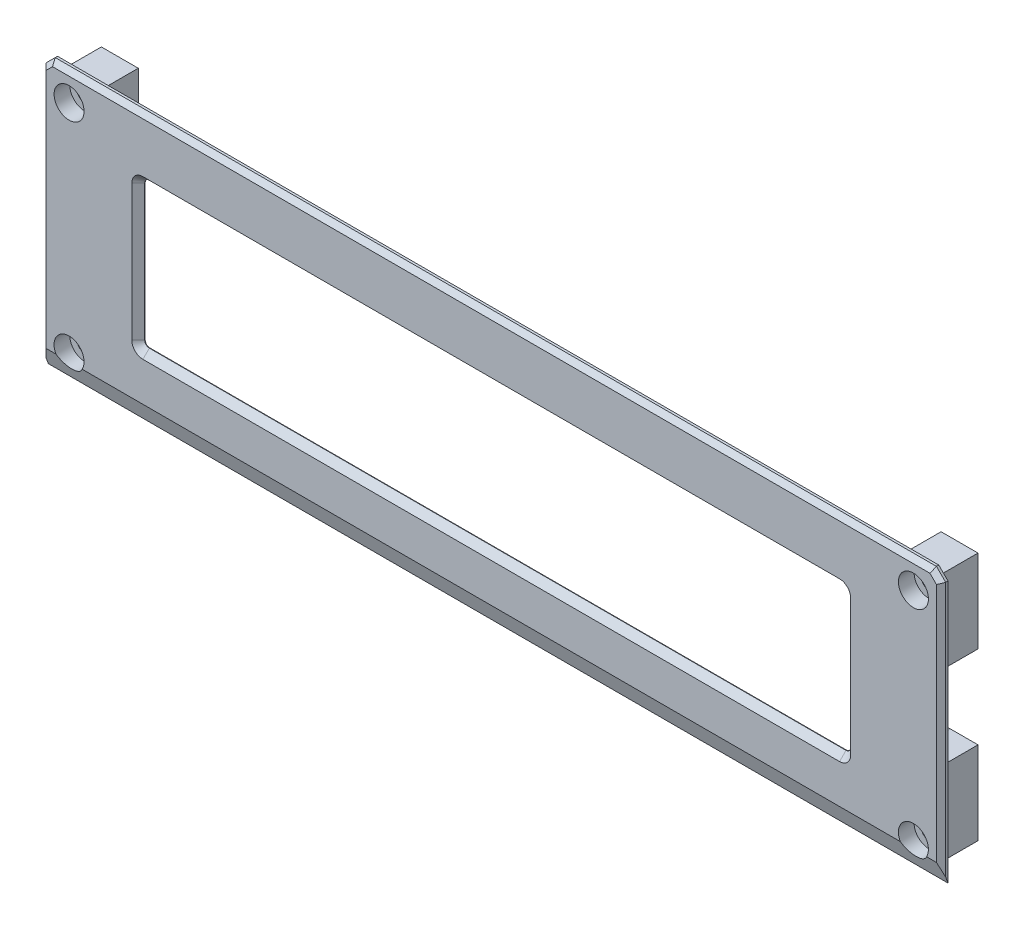
from build123d import *

# Parameters (mm, degrees)
CROQUIS1_W                                           = 195
CROQUIS1_H                                           = 58.7
CROQUIS1_W_2                                         = 153
CROQUIS1_H_2                                         = 31.5
SALIENTE_EXTRUIR1_DEPTH                              = 1.5
REDONDEO1_R                                          = 1
CHAFL_N1_SIZE                                        = 1.4
CORTAR_EXTRUIR1_DEPTH                                = 198.22449138
CROQUIS3_W                                           = 8
CROQUIS3_H                                           = 18
CROQUIS3_H_2                                         = 10
SALIENTE_EXTRUIR2_DEPTH                              = 9
CROQUIS4_W                                           = 174
CROQUIS4_H                                           = 4
CROQUIS4_W_2                                         = 4
CROQUIS4_H_2                                         = 18
CROQUIS4_H_3                                         = 34
SALIENTE_EXTRUIR3_DEPTH                              = 2
REDONDEO2_R                                          = 2
REFRENTADO_PARA_TORNILLO_CON_CABEZA_HUEC_D           = 3.4
REFRENTADO_PARA_TORNILLO_CON_CABEZA_HUEC_CBORE_D     = 6.5
REFRENTADO_PARA_TORNILLO_CON_CABEZA_HUEC_CBORE_DEPTH = 3.4
CHAFL_N2_SIZE                                        = 2
CHAFL_N3_SIZE                                        = 1


with BuildPart() as part:
    # Croquis1 → Saliente-Extruir1 (new body)
    with BuildSketch(Plane.XY):
        with Locations((0, 0.15)):
            Rectangle(CROQUIS1_W, CROQUIS1_H)
        with Locations((0, 0.51)):
            Rectangle(CROQUIS1_W_2, CROQUIS1_H_2, mode=Mode.SUBTRACT)
    extrude(amount=SALIENTE_EXTRUIR1_DEPTH)

    # Redondeo1
    redondeo1_edges = [part.edges().sort_by_distance(p)[0] for p in [
        (-76.5, 16.26, 0.75),
        (-76.5, -15.24, 0.75),
        (76.5, -15.24, 0.75),
        (76.5, 16.26, 0.75),
    ]]
    fillet(redondeo1_edges, radius=REDONDEO1_R)

    # Chaflán1
    chafl_n1_edges = [part.edges().sort_by_distance(p)[0] for p in [
        (-76.5, 0.51, 1.5),
        (0, -15.24, 1.5),
        (76.5, 0.51, 1.5),
        (0, 16.26, 1.5),
        (-76.207106781, -14.947106781, 1.5),
        (76.207106781, -14.947106781, 1.5),
        (76.207106781, 15.967106781, 1.5),
        (-76.207106781, 15.967106781, 1.5),
    ]]
    chamfer(chafl_n1_edges, length=CHAFL_N1_SIZE)

    # Croquis2 → Cortar-Extruir1 (cut, through all)
    with BuildSketch(Plane(origin=(97.5, 0, 0), x_dir=(0, 0, -1), z_dir=(1, 0, 0))):
        Polygon((0, -29.2), (-1.5, -25.078783871), (-1.5, -29.2), align=None)
    extrude(amount=-CORTAR_EXTRUIR1_DEPTH, mode=Mode.SUBTRACT)

    # Croquis3 → Saliente-Extruir2 (add)
    with BuildSketch(Plane(origin=(0, 0, 0), x_dir=(-1, 0, 0), z_dir=(0, 0, -1))):
        with Locations((-91, 18)):
            Rectangle(CROQUIS3_W, CROQUIS3_H)
        with Locations((-91, -18)):
            Rectangle(CROQUIS3_W, CROQUIS3_H)
        with Locations((91, 22)):
            Rectangle(CROQUIS3_W, CROQUIS3_H_2)
        with Locations((91, -22)):
            Rectangle(CROQUIS3_W, CROQUIS3_H_2)
    extrude(amount=SALIENTE_EXTRUIR2_DEPTH)

    # Croquis4 → Saliente-Extruir3 (add)
    with BuildSketch(Plane(origin=(0, 0, 0), x_dir=(-1, 0, 0), z_dir=(0, 0, -1))):
        with Locations((0, 25)):
            Rectangle(CROQUIS4_W, CROQUIS4_H)
        with Locations((0, -25)):
            Rectangle(CROQUIS4_W, CROQUIS4_H)
        with Locations((-93, 0)):
            Rectangle(CROQUIS4_W_2, CROQUIS4_H_2)
        with Locations((93, 0)):
            Rectangle(CROQUIS4_W_2, CROQUIS4_H_3)
    extrude(amount=SALIENTE_EXTRUIR3_DEPTH)

    # Redondeo2
    redondeo2_edges = [part.edges().sort_by_distance(p)[0] for p in [
        (-87, 17, -4.5),
        (-87, -17, -4.5),
        (87, -9, -4.5),
        (87, 9, -4.5),
        (91, -9, -1),
        (87, -23, -1),
        (-87, -23, -1),
        (-91, -17, -1),
        (-91, 17, -1),
        (-87, 23, -1),
        (87, 23, -1),
        (91, 9, -1),
    ]]
    fillet(redondeo2_edges, radius=REDONDEO2_R - 0.0001)  # a hair under: the kernel refuses the full size

    # Refrentado para tornillo con cabeza hueca de M31 (through all)
    with Locations(Plane.XY.offset(1.5)):
        with Locations((-91.5, 23.5), (-91.5, -23.5), (91.5, -23.5), (91.5, 23.5)):
            CounterBoreHole(REFRENTADO_PARA_TORNILLO_CON_CABEZA_HUEC_D / 2, REFRENTADO_PARA_TORNILLO_CON_CABEZA_HUEC_CBORE_D / 2, REFRENTADO_PARA_TORNILLO_CON_CABEZA_HUEC_CBORE_DEPTH)

    # Chaflán2
    chafl_n2_edges = [part.edges().sort_by_distance(p)[0] for p in [
        (-97.5, 29.5, 0.75),
        (97.5, 29.5, 0.75),
    ]]
    chamfer(chafl_n2_edges, length=CHAFL_N2_SIZE)

    # Chaflán3
    chafl_n3_edges = [part.edges().sort_by_distance(p)[0] for p in [
        (0, 29.5, 1.5),
        (-97.5, 1.210608065, 1.5),
        (-96.5, 28.5, 1.5),
        (96.5, 28.5, 1.5),
        (97.5, 1.210608065, 1.5),
    ]]
    chamfer(chafl_n3_edges, length=CHAFL_N3_SIZE)


solid = part.part
